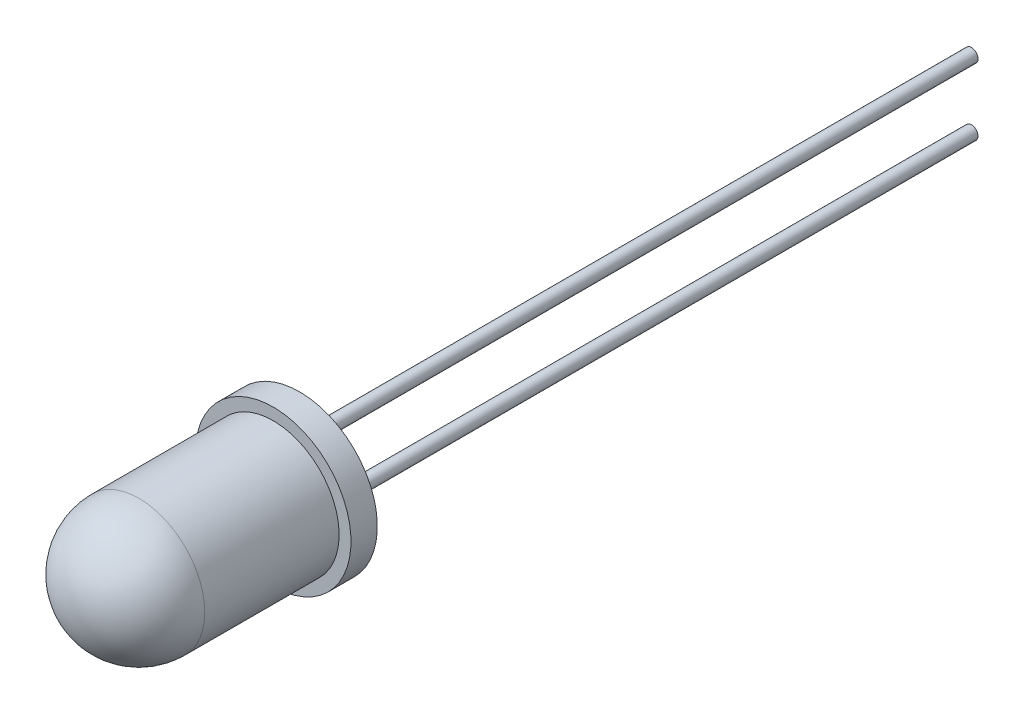
from build123d import *

# Parameters (mm, degrees)
SKETCH_1_R      = 2.5
EXTRUDE_1_DEPTH = 7.6
FILLET_1_R      = 2.5
SKETCH_2_R      = 2.95
EXTRUDE_2_DEPTH = 1
EXTRUDE_START   = 0.5
SKETCH_3_R      = 2.5
EXTRUDE_3_DEPTH = 0.5
CHAMFER_1_SIZE  = 0.5
SKETCH_4_R      = 0.25
EXTRUDE_4_DEPTH = 25


with BuildPart() as part:
    # Эскиз1 → Бобышка-Вытянуть1 (new body)
    with BuildSketch(Plane.XY):
        with Locations(Location((0, 0, 0), (0, 0, 180))):
            Circle(SKETCH_1_R)
    extrude(amount=EXTRUDE_1_DEPTH)

    # Скругление1
    fillet_1_edges = [part.edges().sort_by_distance(p)[0] for p in [
        (2.5, 0, 7.6),
    ]]
    fillet(fillet_1_edges, radius=FILLET_1_R)

    # Эскиз2 → Бобышка-Вытянуть2 (add)
    with BuildSketch(Plane(origin=(0, 0, 0), x_dir=(-1, 0, 0), z_dir=(0, 0, -1))):
        Circle(SKETCH_2_R)
    extrude(amount=EXTRUDE_2_DEPTH)

    # Эскиз3 → Бобышка-Вытянуть3 (add)
    with BuildSketch(Plane(origin=(0, 0, -1), x_dir=(-1, 0, 0), z_dir=(0, 0, -1)).offset(EXTRUDE_START)):
        Circle(SKETCH_3_R)
    extrude(amount=-EXTRUDE_3_DEPTH)

    # Фаска1
    chamfer_1_edges = [part.edges().sort_by_distance(p)[0] for p in [
        (2.5, 0, -1.5),
    ]]
    chamfer(chamfer_1_edges, length=CHAMFER_1_SIZE - 0.0001)  # a hair under: the kernel refuses the full size

    # Эскиз4 → Бобышка-Вытянуть4 (add)
    with BuildSketch(Plane(origin=(0, 0, -1.5), x_dir=(-1, 0, 0), z_dir=(0, 0, -1))):
        with Locations((0, 1.27)):
            Circle(SKETCH_4_R)
        with Locations((0, -1.27)):
            Circle(SKETCH_4_R)
    extrude(amount=EXTRUDE_4_DEPTH)


solid = part.part
